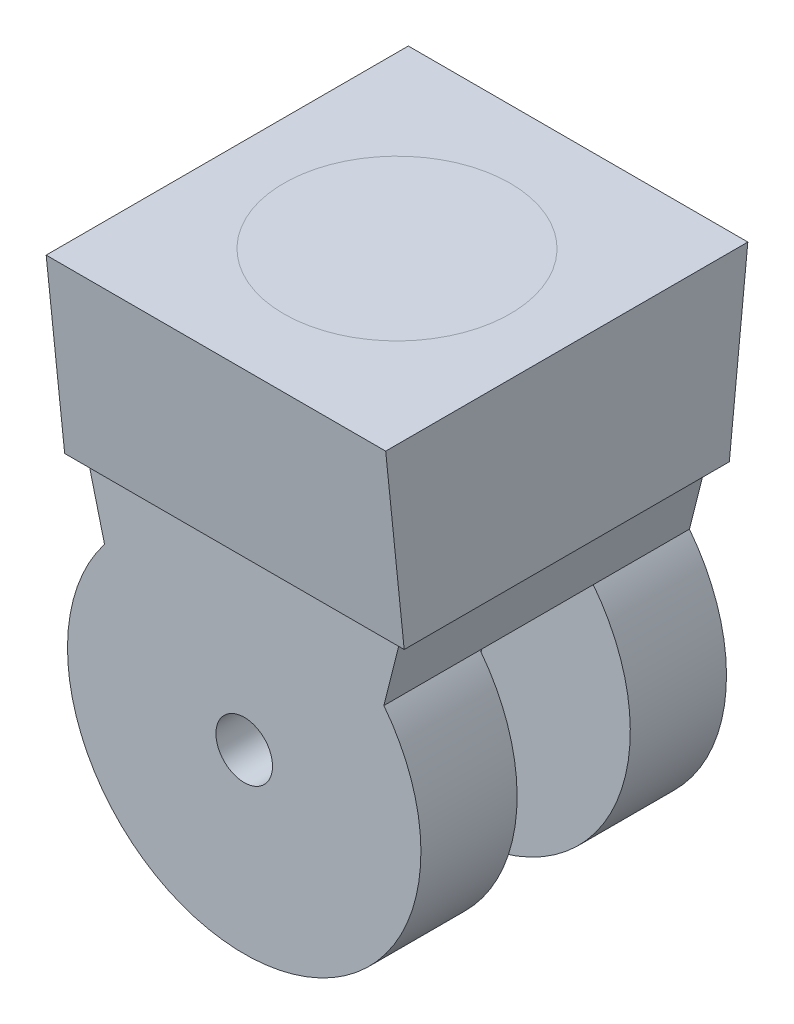
from build123d import *

# Parameters (mm, degrees)
SALIENTE_EXTRUIR1_DEPTH = 38.1
SALIENTE_EXTRUIR2_DEPTH = 34.29
CROQUIS3_R              = 39.658757808
CORTAR_EXTRUIR1_DEPTH   = 12.7
CROQUIS4_R              = 6.35
CORTAR_EXTRUIR2_DEPTH   = 131.824143368


with BuildPart() as part:
    # Croquis1 → Saliente-Extruir1 (new, symmetric)
    with BuildSketch(Plane(origin=(0, 0, 0), x_dir=(0, 0, -1), z_dir=(1, 0, 0))):
        Polygon((-40.64, 20.319999995), (-36.486122257, -20.319999995), (0, -20.319999995), (36.486122257, -20.319999995), (40.64, 20.319999995), align=None)
    extrude(amount=SALIENTE_EXTRUIR1_DEPTH, both=True)

    # Croquis2 → Saliente-Extruir2 (add, symmetric)
    with BuildSketch(Plane.XY):
        with BuildLine():
            Line((35.223664747, -20.319999995), (31.348920302, -35.687560492))
            ThreePointArc((31.348920302, -35.687560492), (0, -99.63751561), (-31.348920302, -35.687560492))
            Line((-31.348920302, -35.687560492), (-35.223664747, -20.319999995))
            Line((-35.223664747, -20.319999995), (35.223664747, -20.319999995))
        make_face()
    extrude(amount=SALIENTE_EXTRUIR2_DEPTH, both=True)

    # Croquis3 → Cortar-Extruir1 (cut, symmetric)
    with BuildSketch(Plane.XY):
        with Locations((0, -59.978757803)):
            Circle(CROQUIS3_R)
    extrude(amount=CORTAR_EXTRUIR1_DEPTH, both=True, mode=Mode.SUBTRACT)

    # Croquis4 → Cortar-Extruir2 (cut, through all)
    with BuildSketch(Plane.XY.offset(34.29)):
        with Locations((0, -59.978757803)):
            Circle(CROQUIS4_R)
    extrude(amount=-CORTAR_EXTRUIR2_DEPTH, mode=Mode.SUBTRACT)


solid = part.part
